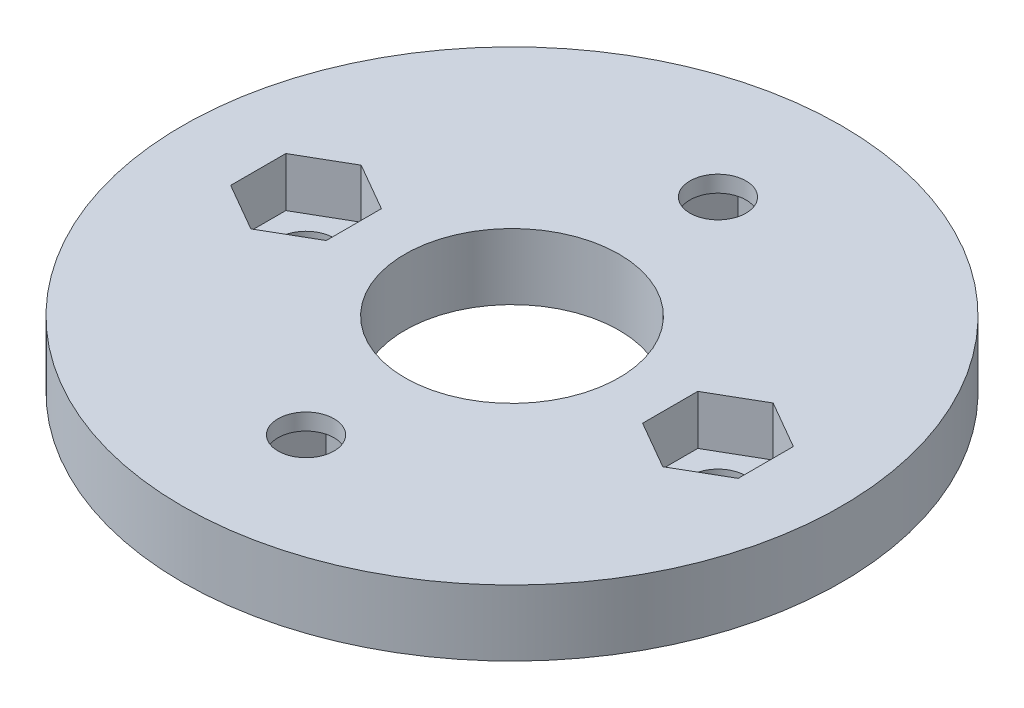
from build123d import *

# Parameters (mm, degrees)
SKETCH_1_R               = 20
SKETCH_1_R_2             = 6.5
EXTRUDE_368_DEPTH        = 4
CUT_EXTRUDE_598_DEPTH    = 3
SKETCH_3_R               = 1.7
CUT_EXTRUDE_786_DEPTH    = 29.442925307
PATTERN_CIRCULAR_1_COUNT = 4
CUT_EXTRUDE_1522_DEPTH   = 3


with BuildPart() as part:
    # Эскиз1 → Extrude 368 (new body)
    with BuildSketch(Plane(origin=(0, 0, 0), x_dir=(1, 0, 0), z_dir=(0, 1, 0))):
        Circle(SKETCH_1_R)
        Circle(SKETCH_1_R_2, mode=Mode.SUBTRACT)
    extrude(amount=EXTRUDE_368_DEPTH)

    # Эскиз2 → Cut-Extrude 598 (cut)
    with BuildSketch(Plane(origin=(0, 4, 0), x_dir=(1, 0, 0), z_dir=(0, 1, 0))):
        Polygon((-15.4, -1.674315781), (-12.5, -3.348631561), (-9.6, -1.674315781), (-9.6, 1.674315781), (-12.5, 3.348631561), (-15.4, 1.674315781), align=None)
        Polygon((15.4, 1.674315781), (12.5, 3.348631561), (9.6, 1.674315781), (9.6, -1.674315781), (12.5, -3.348631561), (15.4, -1.674315781), align=None)
    extrude(amount=-CUT_EXTRUDE_598_DEPTH, mode=Mode.SUBTRACT)

    # Эскиз3 → Cut-Extrude 786 (cut, symmetric)
    with BuildSketch(Plane(origin=(0, 1, 0), x_dir=(1, 0, 0), z_dir=(0, 1, 0))):
        with Locations((12.5, 0)):
            Circle(SKETCH_3_R)
    cut_extrude_786 = extrude(amount=CUT_EXTRUDE_786_DEPTH, both=True, mode=Mode.SUBTRACT)

    # Круговой массив1: Cut-Extrude 786 ×4 about axis
    pattern_circular_1_axis = Axis((0, 4, 0), (0, -1, 0))
    for i in range(1, PATTERN_CIRCULAR_1_COUNT):
        add(cut_extrude_786.rotate(pattern_circular_1_axis, i * 360 / PATTERN_CIRCULAR_1_COUNT), mode=Mode.SUBTRACT)

    # Эскиз5 → Cut-Extrude 1522 (cut)
    with BuildSketch(Plane.XZ):
        Polygon((3.348631561, 12.5), (1.674315781, 15.4), (-1.674315781, 15.4), (-3.348631561, 12.5), (-1.674315781, 9.6), (1.674315781, 9.6), align=None)
        Polygon((-3.348631561, -12.5), (-1.674315781, -15.4), (1.674315781, -15.4), (3.348631561, -12.5), (1.674315781, -9.6), (-1.674315781, -9.6), align=None)
    extrude(amount=-CUT_EXTRUDE_1522_DEPTH, mode=Mode.SUBTRACT)


solid = part.part
